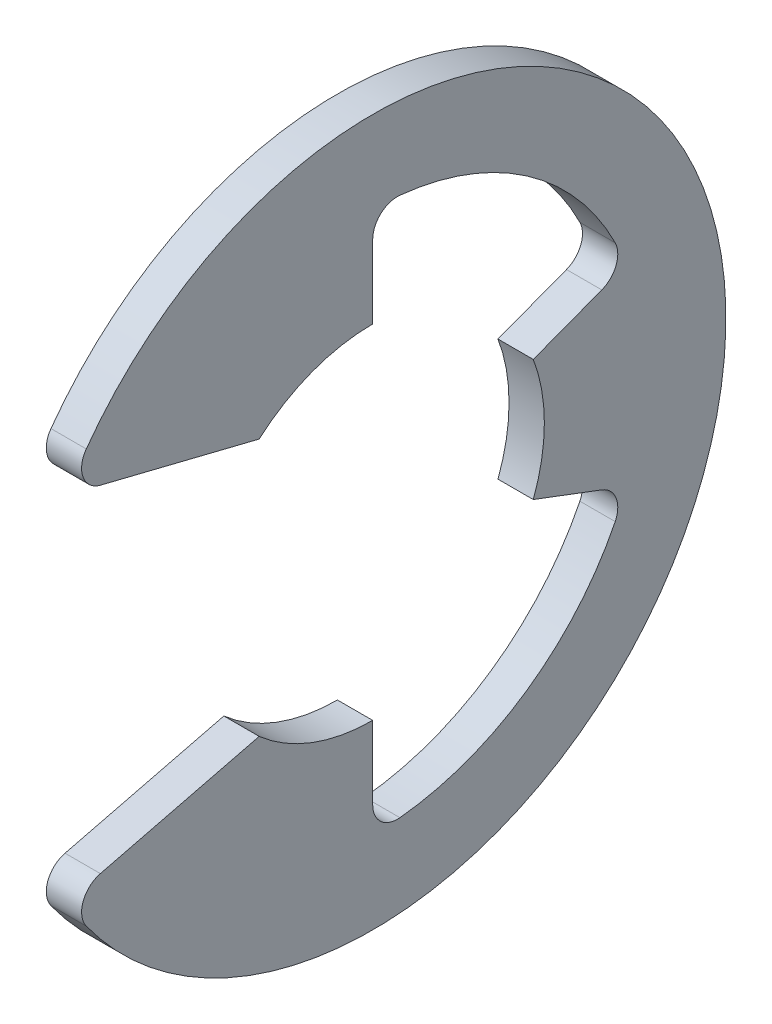
from build123d import *

# Parameters (mm, degrees)
EXTRUDE1_DEPTH = 0.3175
FILLET1_R      = 0.4445


with BuildPart() as part:
    # Sketch1 → Extrude1 (new, symmetric)
    with BuildSketch(Plane(origin=(0, 0, 0), x_dir=(0, 0, -1), z_dir=(1, 0, 0))):
        with BuildLine():
            Line((-5.500228654, -3.173323929), (-2.04126328, -2.314575))
            ThreePointArc((-2.04126328, -2.314575), (-1.091101119, -2.886782215), (0, -3.0861))
            Line((0, -3.0861), (0, -4.870245161))
            ThreePointArc((0, -4.870245161), (2.768867391, -4.006577255), (4.555697196, -1.72189169))
            Line((4.555697196, -1.72189169), (2.886782215, -1.091101119))
            ThreePointArc((2.886782215, -1.091101119), (3.0861, 0), (2.886782215, 1.091101119))
            Line((2.886782215, 1.091101119), (4.555697196, 1.72189169))
            ThreePointArc((4.555697196, 1.72189169), (2.768867391, 4.006577255), (0, 4.870245161))
            Line((0, 4.870245161), (0, 3.0861))
            ThreePointArc((0, 3.0861), (-1.091101119, 2.886782215), (-2.04126328, 2.314575))
            Line((-2.04126328, 2.314575), (-5.500228654, 3.173323929))
            ThreePointArc((-5.500228654, 3.173323929), (6.35, 0), (-5.500228654, -3.173323929))
        make_face()
    extrude(amount=EXTRUDE1_DEPTH, both=True)

    # Fillet1
    fillet1_edges = [part.edges().sort_by_distance(p)[0] for p in [
        (0, -4.870245161, 0),
        (0, 4.870245161, 0),
        (0, -3.173323929, 5.500228654),
        (0, 3.173323929, 5.500228654),
        (0, -1.72189169, -4.555697196),
        (0, 1.72189169, -4.555697196),
    ]]
    fillet(fillet1_edges, radius=FILLET1_R)


solid = part.part
